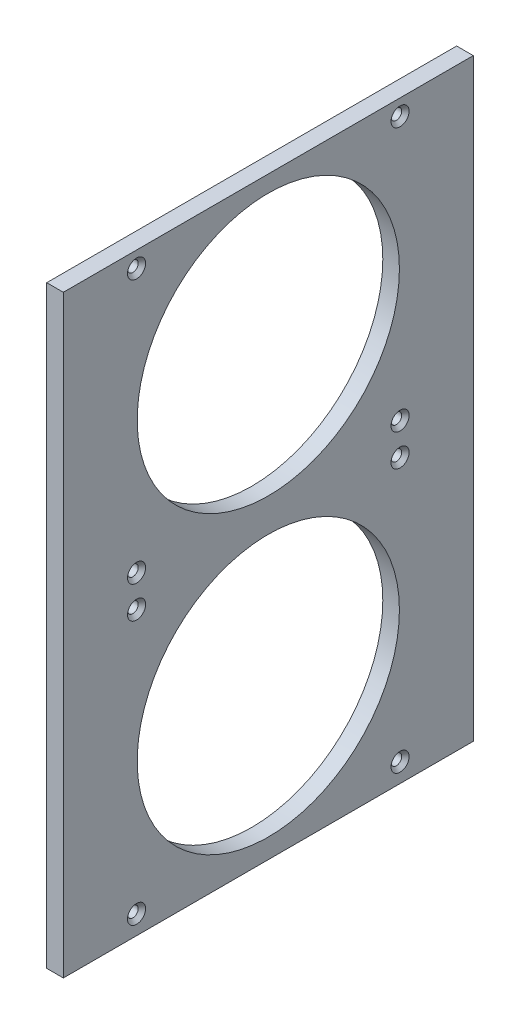
from build123d import *
from OCP.BRepFilletAPI import BRepFilletAPI_MakeChamfer

# Parameters (mm, degrees)
SKETCH1_W                     = 166.5
SKETCH1_H                     = 111
BOSS_EXTRUDE1_DEPTH           = 30.5
SHELL1_T                      = -4.5
CUT_EXTRUDE1_REACH            = 105.377
SKETCH2_W                     = 157
SKETCH2_H                     = 92
TAP_DRILL_FOR_6_32_TAP1_D     = 2.90068
TAP_DRILL_FOR_6_32_TAP1_DEPTH = 4.5
LPATTERN1_COUNT               = 8
LPATTERN1_PITCH               = 30.5
SKETCH7_W                     = 102
SKETCH7_H                     = 4.5
CUT_EXTRUDE2_DEPTH            = 5
SKETCH8_W                     = 102
SKETCH8_H                     = 157
CUT_EXTRUDE3_DEPTH            = 5
CUT_EXTRUDE4_REACH            = 302.564
SKETCH9_R                     = 35.5
TAP_DRILL_FOR_6_32_TAP2_D     = 2.90068
SKETCH13_W                    = 166.5
SKETCH13_H                    = 92
BOSS_EXTRUDE2_DEPTH           = 4.5
CUT_EXTRUDE7_DEPTH            = 157
MIRROR6_COPY_1_DEPTH          = 157
CUT_EXTRUDE11_REACH           = 364.095
SKETCH31_W                    = 5
SKETCH31_H                    = 102
SKETCH33_W                    = 4.5
SKETCH33_H                    = 149.2
BOSS_EXTRUDE3_DEPTH           = 4.5
LPATTERN2_COUNT               = 3
LPATTERN2_PITCH               = 81
CUT_EXTRUDE12_REACH           = 394.531
SKETCH34_W                    = 4.5
SKETCH34_H                    = 11.5
SKETCH35_W                    = 4.5
SKETCH35_H                    = 149.2
BOSS_EXTRUDE4_DEPTH           = 4.5
SKETCH36_W                    = 14
SKETCH36_H                    = 38
SKETCH36_W_2                  = 24
SKETCH36_H_2                  = 12
SKETCH36_W_3                  = 12
SKETCH36_H_3                  = 14
BOSS_EXTRUDE5_DEPTH           = 4.5
CUT_EXTRUDE13_REACH           = 394.531
SKETCH37_R                    = 1.45
BOSS_EXTRUDE6_START           = -4.5
BOSS_EXTRUDE6_DEPTH           = 4.5
SKETCH39_R                    = 3.5
CUT_EXTRUDE14_DEPTH           = 2.5
CUT_EXTRUDE14_DRAFT           = -39
CUT_EXTRUDE14_PROFILE_2_DEPTH = 2.5
CUT_EXTRUDE14_PROFILE_2_DRAFT = -39
CUT_EXTRUDE14_PROFILE_3_DEPTH = 2.5
CUT_EXTRUDE14_PROFILE_3_DRAFT = -39
CUT_EXTRUDE14_PROFILE_4_DEPTH = 2.5
CUT_EXTRUDE14_PROFILE_4_DRAFT = -39
CHAMFER1_SIZE                 = 4.5
SKETCH41_W                    = 166.5
SKETCH41_H                    = 314
BOSS_EXTRUDE7_DEPTH           = 4.5
CUT_EXTRUDE15_REACH           = 367.087
CHAMFER2_SIZE                 = 2.7
CHAMFER2_SIZE2                = 2.18641689
CHAMFER3_SIZE                 = 2.7
CHAMFER3_SIZE2                = 2.18641689
CHAMFER4_SIZE                 = 2.7
CHAMFER4_SIZE2                = 2.18641689
CHAMFER5_SIZE                 = 1
FILLET1_R                     = 4
FILLET2_R                     = 4
FILLET3_R                     = 4
CHAMFER6_SIZE                 = 20
CUT_EXTRUDE16_DEPTH           = 331.942309952
CUT_EXTRUDE16_DEPTH_BACK      = 331.942309952
SKETCH44_W                    = 162
SKETCH44_H                    = 248.5
CUT_EXTRUDE17_DEPTH           = 356.497538669
CUT_EXTRUDE17_DEPTH_BACK      = 356.497538669
SKETCH45_W                    = 203
SKETCH45_H                    = 248.5
CUT_EXTRUDE18_DEPTH           = 251.272851105
CUT_EXTRUDE18_DEPTH_BACK      = 251.272851105
SKETCH46_W                    = 111
SKETCH46_H                    = 87.6961641


with BuildPart() as part:
    # Sketch1 → Boss-Extrude1 (new body)
    with BuildSketch(Plane(origin=(0, 0, 0), x_dir=(1, 0, 0), z_dir=(0, 1, 0))):
        Rectangle(SKETCH1_W, SKETCH1_H)
    extrude(amount=BOSS_EXTRUDE1_DEPTH)

    # Shell1
    shell1_openings = [part.faces().sort_by_distance(p)[0] for p in [
        (0, 30.5, 0),
        (-83.25, 15.25, 0),
    ]]
    offset(amount=SHELL1_T, openings=shell1_openings, kind=Kind.INTERSECTION)

    # Sketch2 → Cut-Extrude1 (cut, up to next)
    with BuildSketch(Plane(origin=(0, 4.5, 0), x_dir=(1, 0, 0), z_dir=(0, 1, 0)), mode=Mode.PRIVATE) as cut_extrude1_sk1:
        with Locations((0.25, 0)):
            Rectangle(SKETCH2_W, SKETCH2_H)
    cut_extrude1_tool1 = extrude(cut_extrude1_sk1.sketch, amount=-CUT_EXTRUDE1_REACH, mode=Mode.PRIVATE) & part.part
    add(cut_extrude1_tool1.solids().sort_by_distance((0.25, 4.5, 0))[0], mode=Mode.SUBTRACT)

    # Tap Drill for #6-32 Tap1
    with Locations(Plane(origin=(0, 0, -55.5), x_dir=(-1, 0, 0), z_dir=(0, 0, -1))):
        with Locations((47.66, 10.84), (-53.75, 10.84)):
            tap_drill_for_6_32_tap1 = Hole(TAP_DRILL_FOR_6_32_TAP1_D / 2, depth=TAP_DRILL_FOR_6_32_TAP1_DEPTH)

    # Mirror1: Tap Drill for #6-32 Tap1 across plane
    add(tap_drill_for_6_32_tap1.mirror(Plane.XY), mode=Mode.SUBTRACT)


with BuildPart() as lpattern1_1:
    # LPattern1: pattern copy
    add(part.part.moved(Location(Vector(0, 1, 0) * (1 * LPATTERN1_PITCH))))


with BuildPart() as lpattern1_2:
    # LPattern1: pattern copy
    add(part.part.moved(Location(Vector(0, 1, 0) * (2 * LPATTERN1_PITCH))))


with BuildPart() as lpattern1_3:
    # LPattern1: pattern copy
    add(part.part.moved(Location(Vector(0, 1, 0) * (3 * LPATTERN1_PITCH))))


with BuildPart() as lpattern1_4:
    # LPattern1: pattern copy
    add(part.part.moved(Location(Vector(0, 1, 0) * (4 * LPATTERN1_PITCH))))


with BuildPart() as lpattern1_5:
    # LPattern1: pattern copy
    add(part.part.moved(Location(Vector(0, 1, 0) * (5 * LPATTERN1_PITCH))))


with BuildPart() as lpattern1_6:
    # LPattern1: pattern copy
    add(part.part.moved(Location(Vector(0, 1, 0) * (6 * LPATTERN1_PITCH))))


with BuildPart() as lpattern1_7:
    # LPattern1: pattern copy
    add(part.part.moved(Location(Vector(0, 1, 0) * (7 * LPATTERN1_PITCH))))


with BuildPart() as part_1:
    add(part.part)

    # Combine1: union LPattern1_1
    add(lpattern1_1.part)

    # Sketch7 → Cut-Extrude2 (cut)
    with BuildSketch(Plane.ZY.offset(83.25)):
        with Locations((0, 32.75)):
            Rectangle(SKETCH7_W, SKETCH7_H)
    extrude(amount=-CUT_EXTRUDE2_DEPTH, mode=Mode.SUBTRACT)


with BuildPart() as lpattern1_2_1:
    add(lpattern1_2.part)

    # Combine2: union LPattern1_3, LPattern1_5, LPattern1_4, LPattern1_7, part, LPattern1_6
    add(lpattern1_3.part)
    add(lpattern1_5.part)
    add(lpattern1_4.part)
    add(lpattern1_7.part)
    add(part_1.part)
    add(lpattern1_6.part)

    # Sketch8 → Cut-Extrude3 (cut)
    with BuildSketch(Plane.ZY.offset(83.25)):
        with Locations((0, 139.5)):
            Rectangle(SKETCH8_W, SKETCH8_H)
    extrude(amount=-CUT_EXTRUDE3_DEPTH, mode=Mode.SUBTRACT)

    # Sketch9 → Cut-Extrude4 (cut, up to next)
    with BuildSketch(Plane(origin=(83.25, 0, 0), x_dir=(0, 0, -1), z_dir=(1, 0, 0)), mode=Mode.PRIVATE) as cut_extrude4_sk1:
        with Locations((0, 204)):
            Circle(SKETCH9_R)
    cut_extrude4_tool1 = extrude(cut_extrude4_sk1.sketch, amount=-CUT_EXTRUDE4_REACH, mode=Mode.PRIVATE) & lpattern1_2_1.part
    # Sketch9 → Cut-Extrude4 (cut, up to next)
    with BuildSketch(Plane(origin=(83.25, 0, 0), x_dir=(0, 0, -1), z_dir=(1, 0, 0)), mode=Mode.PRIVATE) as cut_extrude4_sk2:
        with Locations((0, 124)):
            Circle(SKETCH9_R)
    cut_extrude4_tool2 = extrude(cut_extrude4_sk2.sketch, amount=-CUT_EXTRUDE4_REACH, mode=Mode.PRIVATE) & lpattern1_2_1.part
    # Sketch9 → Cut-Extrude4 (cut, up to next)
    with BuildSketch(Plane(origin=(83.25, 0, 0), x_dir=(0, 0, -1), z_dir=(1, 0, 0)), mode=Mode.PRIVATE) as cut_extrude4_sk3:
        with Locations((0, 44)):
            Circle(SKETCH9_R)
    cut_extrude4_tool3 = extrude(cut_extrude4_sk3.sketch, amount=-CUT_EXTRUDE4_REACH, mode=Mode.PRIVATE) & lpattern1_2_1.part
    add(cut_extrude4_tool1.solids().sort_by_distance((83.25, 204, 0))[0], mode=Mode.SUBTRACT)
    add(cut_extrude4_tool2.solids().sort_by_distance((83.25, 124, 0))[0], mode=Mode.SUBTRACT)
    add(cut_extrude4_tool3.solids().sort_by_distance((83.25, 44, 0))[0], mode=Mode.SUBTRACT)

    # Tap Drill for #6-32 Tap2 (through all)
    with Locations(Plane(origin=(83.25, 0, 0), x_dir=(0, 0, -1), z_dir=(1, 0, 0))):
        with Locations((-35.675, 239.675), (35.675, 239.675), (35.675, 168.325), (-35.675, 168.325)):
            tap_drill_for_6_32_tap2 = Hole(TAP_DRILL_FOR_6_32_TAP2_D / 2)

    # Mirror2: Tap Drill for #6-32 Tap2 across plane
    add(tap_drill_for_6_32_tap2.mirror(Plane.ZX.offset(164)), mode=Mode.SUBTRACT)

    # Mirror3: Tap Drill for #6-32 Tap2 across plane
    add(tap_drill_for_6_32_tap2.mirror(Plane.ZX.offset(124)), mode=Mode.SUBTRACT)

    # Sketch13 → Boss-Extrude2 (add)
    with BuildSketch(Plane.XZ):
        with Locations((0, -101.5)):
            Rectangle(SKETCH13_W, SKETCH13_H)
    extrude(amount=-BOSS_EXTRUDE2_DEPTH)

    # Mirror4: LPattern1_2 across plane


with BuildPart() as lpattern1_2_2:
    add(lpattern1_2_1.part)
    add(lpattern1_2_1.part.mirror(Plane(origin=(0, 0, -101.5), x_dir=(1, 0, 0), z_dir=(0, 0, -1))))

    # Sketch17 → Cut-Extrude7 (cut)
    with BuildSketch(Plane.ZY.offset(78.25)):
        Polygon((-46, 35), (-51, 30.5), (-46, 30.5), align=None)
        Polygon((-51, 61), (-46, 65.5), (-46, 61), align=None)
        Polygon((-51, 91.5), (-46, 96), (-46, 91.5), align=None)
        Polygon((-51, 122), (-46, 126.5), (-46, 122), align=None)
        Polygon((-51, 152.5), (-46, 157), (-46, 152.5), align=None)
        Polygon((-51, 183), (-46, 187.5), (-46, 183), align=None)
        Polygon((-51, 213.5), (-46, 218), (-46, 213.5), align=None)
    cut_extrude7 = extrude(amount=-CUT_EXTRUDE7_DEPTH, mode=Mode.SUBTRACT)

    # Mirror5: Cut-Extrude7 across plane
    add(cut_extrude7.mirror(Plane.XY), mode=Mode.SUBTRACT)

    # Mirror6: Cut-Extrude7 across plane
    add(cut_extrude7.mirror(Plane(origin=(0, 0, -101.5), x_dir=(1, 0, 0), z_dir=(0, 0, -1))), mode=Mode.SUBTRACT)

    # Mirror6 copy 1 sketch → Mirror6 copy 1 (cut)
    with BuildSketch(Plane(origin=(-78.25, 0, -203), x_dir=(0, 0, 1), z_dir=(-1, 0, 0))):
        Polygon((-46, 35), (-51, 30.5), (-46, 30.5), align=None)
        Polygon((-51, 61), (-46, 65.5), (-46, 61), align=None)
        Polygon((-51, 91.5), (-46, 96), (-46, 91.5), align=None)
        Polygon((-51, 122), (-46, 126.5), (-46, 122), align=None)
        Polygon((-51, 152.5), (-46, 157), (-46, 152.5), align=None)
        Polygon((-51, 183), (-46, 187.5), (-46, 183), align=None)
        Polygon((-51, 213.5), (-46, 218), (-46, 213.5), align=None)
    extrude(amount=-MIRROR6_COPY_1_DEPTH, mode=Mode.SUBTRACT)

    # Sketch31 → Cut-Extrude11 (cut, up to next)
    with BuildSketch(Plane(origin=(0, 4.5, 0), x_dir=(1, 0, 0), z_dir=(0, 1, 0)), mode=Mode.PRIVATE) as cut_extrude11_sk1:
        with Locations((-80.75, 203)):
            Rectangle(SKETCH31_W, SKETCH31_H)
    cut_extrude11_tool1 = extrude(cut_extrude11_sk1.sketch, amount=-CUT_EXTRUDE11_REACH, mode=Mode.PRIVATE) & lpattern1_2_2.part
    # Sketch31 → Cut-Extrude11 (cut, up to next)
    with BuildSketch(Plane(origin=(0, 4.5, 0), x_dir=(1, 0, 0), z_dir=(0, 1, 0)), mode=Mode.PRIVATE) as cut_extrude11_sk2:
        with Locations((-80.75, 0)):
            Rectangle(SKETCH31_W, SKETCH31_H)
    cut_extrude11_tool2 = extrude(cut_extrude11_sk2.sketch, amount=-CUT_EXTRUDE11_REACH, mode=Mode.PRIVATE) & lpattern1_2_2.part
    add(cut_extrude11_tool1.solids().sort_by_distance((-80.75, 4.5, -203))[0], mode=Mode.SUBTRACT)
    add(cut_extrude11_tool2.solids().sort_by_distance((-80.75, 4.5, 0))[0], mode=Mode.SUBTRACT)

    # Sketch33 → Boss-Extrude3 (add)
    with BuildSketch(Plane(origin=(83.25, 0, 0), x_dir=(0, 0, -1), z_dir=(1, 0, 0))):
        with Locations((145.25, 79.1)):
            Rectangle(SKETCH33_W, SKETCH33_H)
    boss_extrude3 = extrude(amount=-BOSS_EXTRUDE3_DEPTH)

    # LPattern2: Boss-Extrude3 ×3
    with Locations(*[(-i * LPATTERN2_PITCH, 0, 0) for i in range(1, LPATTERN2_COUNT)]):
        add(boss_extrude3)

    # Cut-Extrude12: up to this face of the body (flat: up to its plane)
    cut_extrude12_end = Plane(lpattern1_2_2.part.faces().sort_by_distance((2.25, 79.1, -145.25))[0])
    # Sketch34 → Cut-Extrude12 (cut, up to the picked face)
    with BuildSketch(Plane.ZY.offset(83.25), mode=Mode.PRIVATE) as cut_extrude12_sk1:
        Polygon((-147.5, 25), (-143, 25), (-143, 81.35), (-147.5, 76.85), align=None)
    cut_extrude12_tool1 = split(extrude(cut_extrude12_sk1.sketch, amount=-CUT_EXTRUDE12_REACH, mode=Mode.PRIVATE), bisect_by=cut_extrude12_end, keep=Keep.BOTH, mode=Mode.PRIVATE)
    # Sketch34 → Cut-Extrude12 (cut, up to the picked face)
    with BuildSketch(Plane.ZY.offset(83.25), mode=Mode.PRIVATE) as cut_extrude12_sk2:
        with Locations((-145.25, 19.25)):
            Rectangle(SKETCH34_W, SKETCH34_H)
    cut_extrude12_tool2 = split(extrude(cut_extrude12_sk2.sketch, amount=-CUT_EXTRUDE12_REACH, mode=Mode.PRIVATE), bisect_by=cut_extrude12_end, keep=Keep.BOTH, mode=Mode.PRIVATE)
    # Sketch34 → Cut-Extrude12 (cut, up to the picked face)
    with BuildSketch(Plane.ZY.offset(83.25), mode=Mode.PRIVATE) as cut_extrude12_sk3:
        Polygon((-143, 145.7), (-143, 89.35), (-147.5, 89.35), (-147.5, 141.2), align=None)
    cut_extrude12_tool3 = split(extrude(cut_extrude12_sk3.sketch, amount=-CUT_EXTRUDE12_REACH, mode=Mode.PRIVATE), bisect_by=cut_extrude12_end, keep=Keep.BOTH, mode=Mode.PRIVATE)
    add(cut_extrude12_tool1.solids().sort_by(Axis((-83.25, 52.065596, -145.218808), (1, 0, 0)))[0], mode=Mode.SUBTRACT)
    add(cut_extrude12_tool2.solids().sort_by(Axis((-83.25, 19.25, -145.25), (1, 0, 0)))[0], mode=Mode.SUBTRACT)
    add(cut_extrude12_tool3.solids().sort_by(Axis((-83.25, 116.415596, -145.218808), (1, 0, 0)))[0], mode=Mode.SUBTRACT)

    # Sketch35 → Boss-Extrude4 (add)
    with BuildSketch(Plane.ZY.offset(-78.75)):
        with Locations((-145.25, 79.1)):
            Rectangle(SKETCH35_W, SKETCH35_H)
    extrude(amount=BOSS_EXTRUDE4_DEPTH)

    # Sketch36 → Boss-Extrude5 (add)
    with BuildSketch(Plane(origin=(83.25, 0, 0), x_dir=(0, 0, -1), z_dir=(1, 0, 0))):
        with Locations((62.5, 23.5)):
            Rectangle(SKETCH36_W, SKETCH36_H)
        with Locations((67.5, 147.7)):
            Rectangle(SKETCH36_W_2, SKETCH36_H_2)
        with Locations((137, 146.7)):
            Rectangle(SKETCH36_W_3, SKETCH36_H_3)
        with Locations((136, 10.5)):
            Rectangle(SKETCH36_W, SKETCH36_H_2)
    extrude(amount=-BOSS_EXTRUDE5_DEPTH)

    # Sketch37 → Cut-Extrude13 (cut, up to next)
    with BuildSketch(Plane(origin=(83.25, 0, 0), x_dir=(0, 0, -1), z_dir=(1, 0, 0)), mode=Mode.PRIVATE) as cut_extrude13_sk1:
        with Locations((71.32, 147.92)):
            Circle(SKETCH37_R)
    cut_extrude13_tool1 = extrude(cut_extrude13_sk1.sketch, amount=-CUT_EXTRUDE13_REACH, mode=Mode.PRIVATE) & lpattern1_2_2.part
    # Sketch37 → Cut-Extrude13 (cut, up to next)
    with BuildSketch(Plane(origin=(83.25, 0, 0), x_dir=(0, 0, -1), z_dir=(1, 0, 0)), mode=Mode.PRIVATE) as cut_extrude13_sk2:
        with Locations((137.68, 147.92)):
            Circle(SKETCH37_R)
    cut_extrude13_tool2 = extrude(cut_extrude13_sk2.sketch, amount=-CUT_EXTRUDE13_REACH, mode=Mode.PRIVATE) & lpattern1_2_2.part
    # Sketch37 → Cut-Extrude13 (cut, up to next)
    with BuildSketch(Plane(origin=(83.25, 0, 0), x_dir=(0, 0, -1), z_dir=(1, 0, 0)), mode=Mode.PRIVATE) as cut_extrude13_sk3:
        with Locations((61.57, 34.51)):
            Circle(SKETCH37_R)
    cut_extrude13_tool3 = extrude(cut_extrude13_sk3.sketch, amount=-CUT_EXTRUDE13_REACH, mode=Mode.PRIVATE) & lpattern1_2_2.part
    # Sketch37 → Cut-Extrude13 (cut, up to next)
    with BuildSketch(Plane(origin=(83.25, 0, 0), x_dir=(0, 0, -1), z_dir=(1, 0, 0)), mode=Mode.PRIVATE) as cut_extrude13_sk4:
        with Locations((137.55, 10.15)):
            Circle(SKETCH37_R)
    cut_extrude13_tool4 = extrude(cut_extrude13_sk4.sketch, amount=-CUT_EXTRUDE13_REACH, mode=Mode.PRIVATE) & lpattern1_2_2.part
    add(cut_extrude13_tool1.solids().sort_by_distance((83.25, 147.92, -71.32))[0], mode=Mode.SUBTRACT)
    add(cut_extrude13_tool2.solids().sort_by_distance((83.25, 147.92, -137.68))[0], mode=Mode.SUBTRACT)
    add(cut_extrude13_tool3.solids().sort_by_distance((83.25, 34.51, -61.57))[0], mode=Mode.SUBTRACT)
    add(cut_extrude13_tool4.solids().sort_by_distance((83.25, 10.15, -137.55))[0], mode=Mode.SUBTRACT)

    # Sketch38 → Boss-Extrude6 (add)
    with BuildSketch(Plane(origin=(83.25, 0, 0), x_dir=(0, 0, -1), z_dir=(1, 0, 0)).offset(BOSS_EXTRUDE6_START)):
        Polygon((79.5, 141.7), (55.5, 117.7), (55.5, 141.7), align=None)
        Polygon((131, 139.7), (143, 127.7), (143, 139.7), align=None)
    extrude(amount=BOSS_EXTRUDE6_DEPTH)


with BuildPart() as cut_extrude14_tool:
    # Sketch39 → Cut-Extrude14 (with draft: the straight prism first)
    with BuildSketch(Plane(origin=(83.25, 0, 0), x_dir=(0, 0, -1), z_dir=(1, 0, 0))):
        with Locations((71.32, 147.92)):
            Circle(SKETCH39_R)
    extrude(amount=-CUT_EXTRUDE14_DEPTH)
    # Cut-Extrude14: the draft: its side faces are tilted about the plane it starts from
    cut_extrude14_sides = [cut_extrude14_tool.faces().sort_by_distance(p)[0] for p in [
        (82, 147.92, -67.82),
    ]]
    draft(cut_extrude14_sides, Plane(origin=(83.25, 0, 0), x_dir=(0, 0, -1), z_dir=(1, 0, 0)), CUT_EXTRUDE14_DRAFT)


with BuildPart() as lpattern1_2_3:
    add(lpattern1_2_2.part)

    # Cut-Extrude14: cut by cut_extrude14_tool
    add(cut_extrude14_tool.part, mode=Mode.SUBTRACT)


with BuildPart() as cut_extrude14_profile_2_tool:
    # Sketch39 → Cut-Extrude14 profile 2 (with draft: the straight prism first)
    with BuildSketch(Plane(origin=(83.25, 0, 0), x_dir=(0, 0, -1), z_dir=(1, 0, 0))):
        with Locations((137.68, 147.92)):
            Circle(SKETCH39_R)
    extrude(amount=-CUT_EXTRUDE14_PROFILE_2_DEPTH)
    # Cut-Extrude14 profile 2: the draft: its side faces are tilted about the plane it starts from
    cut_extrude14_profile_2_sides = [cut_extrude14_profile_2_tool.faces().sort_by_distance(p)[0] for p in [
        (82, 147.92, -134.18),
    ]]
    draft(cut_extrude14_profile_2_sides, Plane(origin=(83.25, 0, 0), x_dir=(0, 0, -1), z_dir=(1, 0, 0)), CUT_EXTRUDE14_PROFILE_2_DRAFT)


with BuildPart() as lpattern1_2_4:
    add(lpattern1_2_3.part)

    # Cut-Extrude14 profile 2: cut by cut_extrude14_profile_2_tool
    add(cut_extrude14_profile_2_tool.part, mode=Mode.SUBTRACT)


with BuildPart() as cut_extrude14_profile_3_tool:
    # Sketch39 → Cut-Extrude14 profile 3 (with draft: the straight prism first)
    with BuildSketch(Plane(origin=(83.25, 0, 0), x_dir=(0, 0, -1), z_dir=(1, 0, 0))):
        with Locations((137.55, 10.15)):
            Circle(SKETCH39_R)
    extrude(amount=-CUT_EXTRUDE14_PROFILE_3_DEPTH)
    # Cut-Extrude14 profile 3: the draft: its side faces are tilted about the plane it starts from
    cut_extrude14_profile_3_sides = [cut_extrude14_profile_3_tool.faces().sort_by_distance(p)[0] for p in [
        (82, 10.15, -134.05),
    ]]
    draft(cut_extrude14_profile_3_sides, Plane(origin=(83.25, 0, 0), x_dir=(0, 0, -1), z_dir=(1, 0, 0)), CUT_EXTRUDE14_PROFILE_3_DRAFT)


with BuildPart() as lpattern1_2_5:
    add(lpattern1_2_4.part)

    # Cut-Extrude14 profile 3: cut by cut_extrude14_profile_3_tool
    add(cut_extrude14_profile_3_tool.part, mode=Mode.SUBTRACT)


with BuildPart() as cut_extrude14_profile_4_tool:
    # Sketch39 → Cut-Extrude14 profile 4 (with draft: the straight prism first)
    with BuildSketch(Plane(origin=(83.25, 0, 0), x_dir=(0, 0, -1), z_dir=(1, 0, 0))):
        with Locations((61.57, 34.51)):
            Circle(SKETCH39_R)
    extrude(amount=-CUT_EXTRUDE14_PROFILE_4_DEPTH)
    # Cut-Extrude14 profile 4: the draft: its side faces are tilted about the plane it starts from
    cut_extrude14_profile_4_sides = [cut_extrude14_profile_4_tool.faces().sort_by_distance(p)[0] for p in [
        (82, 34.51, -58.07),
    ]]
    draft(cut_extrude14_profile_4_sides, Plane(origin=(83.25, 0, 0), x_dir=(0, 0, -1), z_dir=(1, 0, 0)), CUT_EXTRUDE14_PROFILE_4_DRAFT)


with BuildPart() as lpattern1_2_6:
    add(lpattern1_2_5.part)

    # Cut-Extrude14 profile 4: cut by cut_extrude14_profile_4_tool
    add(cut_extrude14_profile_4_tool.part, mode=Mode.SUBTRACT)

    # Chamfer1
    chamfer1_edges = [lpattern1_2_6.edges().sort_by_distance(p)[0] for p in [
        (81, 42.5, -69.5),
        (81, 153.7, -79.5),
        (81, 153.7, -131),
        (81, 16.5, -129),
    ]]
    chamfer(chamfer1_edges, length=CHAMFER1_SIZE)

    # Sketch41 → Boss-Extrude7 (add)
    with BuildSketch(Plane.XZ):
        with Locations((0, -101.5)):
            Rectangle(SKETCH41_W, SKETCH41_H)
    extrude(amount=BOSS_EXTRUDE7_DEPTH)

    # Sketch42 → Cut-Extrude15 (cut, up to next)
    with BuildSketch(Plane(origin=(0, 0, 0), x_dir=(1, 0, 0), z_dir=(0, 1, 0)), mode=Mode.PRIVATE) as cut_extrude15_sk1:
        with BuildLine():
            Line((-43.85503675, 38), (43.85503675, 38))
            ThreePointArc((43.85503675, 38), (46.750439422, 35.78526643), (45.370811763, 32.411095577))
            Line((45.370811763, 32.411095577), (1.515775013, 6.73445479))
            ThreePointArc((1.515775013, 6.73445479), (0, 6.323359212), (-1.515775013, 6.73445479))
            Line((-1.515775013, 6.73445479), (-45.370811763, 32.411095577))
            ThreePointArc((-45.370811763, 32.411095577), (-46.750439422, 35.78526643), (-43.85503675, 38))
        make_face()
    cut_extrude15_tool1 = extrude(cut_extrude15_sk1.sketch, amount=-CUT_EXTRUDE15_REACH, mode=Mode.PRIVATE) & lpattern1_2_6.part
    # Sketch42 → Cut-Extrude15 (cut, up to next)
    with BuildSketch(Plane(origin=(0, 0, 0), x_dir=(1, 0, 0), z_dir=(0, 1, 0)), mode=Mode.PRIVATE) as cut_extrude15_sk2:
        with BuildLine():
            Line((10.268766853, 2.588904423), (66.234224987, 35.356063488))
            ThreePointArc((66.234224987, 35.356063488), (69.242091646, 35.369785147), (70.75, 32.767159066))
            Line((70.75, 32.767159066), (70.75, -32.767159066))
            ThreePointArc((70.75, -32.767159066), (69.242091646, -35.369785147), (66.234224987, -35.356063488))
            Line((66.234224987, -35.356063488), (10.268766853, -2.588904423))
            ThreePointArc((10.268766853, -2.588904423), (8.784541866, 0), (10.268766853, 2.588904423))
        make_face()
    cut_extrude15_tool2 = extrude(cut_extrude15_sk2.sketch, amount=-CUT_EXTRUDE15_REACH, mode=Mode.PRIVATE) & lpattern1_2_6.part
    # Sketch42 → Cut-Extrude15 (cut, up to next)
    with BuildSketch(Plane(origin=(0, 0, 0), x_dir=(1, 0, 0), z_dir=(0, 1, 0)), mode=Mode.PRIVATE) as cut_extrude15_sk3:
        with BuildLine():
            Line((45.370811763, -32.411095577), (1.515775013, -6.73445479))
            ThreePointArc((1.515775013, -6.73445479), (0, -6.323359212), (-1.515775013, -6.73445479))
            Line((-1.515775013, -6.73445479), (-45.370811763, -32.411095577))
            ThreePointArc((-45.370811763, -32.411095577), (-46.750439422, -35.78526643), (-43.85503675, -38))
            Line((-43.85503675, -38), (43.85503675, -38))
            ThreePointArc((43.85503675, -38), (46.750439422, -35.78526643), (45.370811763, -32.411095577))
        make_face()
    cut_extrude15_tool3 = extrude(cut_extrude15_sk3.sketch, amount=-CUT_EXTRUDE15_REACH, mode=Mode.PRIVATE) & lpattern1_2_6.part
    # Sketch42 → Cut-Extrude15 (cut, up to next)
    with BuildSketch(Plane(origin=(0, 0, 0), x_dir=(1, 0, 0), z_dir=(0, 1, 0)), mode=Mode.PRIVATE) as cut_extrude15_sk4:
        with BuildLine():
            Line((-70.717599058, 32.346124545), (-70.327517287, -33.187032629))
            ThreePointArc((-70.327517287, -33.187032629), (-68.804143961, -35.780637039), (-65.796412263, -35.749011813))
            Line((-65.796412263, -35.749011813), (-10.026986458, -2.64930845))
            ThreePointArc((-10.026986458, -2.64930845), (-8.558197773, -0.051615297), (-10.057806476, 2.528408669))
            Line((-10.057806476, 2.528408669), (-66.217314052, 34.961862479))
            ThreePointArc((-66.217314052, 34.961862479), (-69.225209102, 34.957680085), (-70.717599058, 32.346124545))
        make_face()
    cut_extrude15_tool4 = extrude(cut_extrude15_sk4.sketch, amount=-CUT_EXTRUDE15_REACH, mode=Mode.PRIVATE) & lpattern1_2_6.part
    cut_extrude15_1 = cut_extrude15_tool1.solids().sort_by_distance((0, 0, -27.06052))[0]
    add(cut_extrude15_1, mode=Mode.SUBTRACT)
    cut_extrude15_2 = cut_extrude15_tool2.solids().sort_by_distance((49.111692, 0, 0))[0]
    add(cut_extrude15_2, mode=Mode.SUBTRACT)
    cut_extrude15_3 = cut_extrude15_tool3.solids().sort_by_distance((0, 0, 27.06052))[0]
    add(cut_extrude15_3, mode=Mode.SUBTRACT)
    cut_extrude15_4 = cut_extrude15_tool4.solids().sort_by_distance((-48.884634, 0, 0.291656))[0]
    add(cut_extrude15_4, mode=Mode.SUBTRACT)
    cut_extrude15 = cut_extrude15_1 + cut_extrude15_2 + cut_extrude15_3 + cut_extrude15_4  # Cut-Extrude15 as one shape, for the pattern or mirror that repeats it

    # Mirror7: Cut-Extrude15 across plane
    add(cut_extrude15.mirror(Plane(origin=(0, 0, -101.5), x_dir=(1, 0, 0), z_dir=(0, 0, -1))), mode=Mode.SUBTRACT)

    # Chamfer2
    chamfer2_edges = [lpattern1_2_6.edges().sort_by_distance(p)[0] for p in [
        (52.29966, 10.84, 55.5),
        (-49.11034, 10.84, 55.5),
        (52.29966, 41.34, 55.5),
        (-49.11034, 41.34, 55.5),
        (52.29966, 71.84, 55.5),
        (-49.11034, 71.84, 55.5),
        (52.29966, 102.34, 55.5),
        (-49.11034, 102.34, 55.5),
        (52.29966, 163.34, 55.5),
        (-49.11034, 163.34, 55.5),
        (52.29966, 132.84, 55.5),
        (-49.11034, 132.84, 55.5),
        (52.29966, 224.34, 55.5),
        (-49.11034, 224.34, 55.5),
        (52.29966, 193.84, 55.5),
        (-49.11034, 193.84, 55.5),
    ]]
    chamfer2_side = [lpattern1_2_6.faces().sort_by_distance(p)[0] for p in [
        (-0.007801308, 119.755533933, 55.5),
    ]]
    chamfer(chamfer2_edges, length=CHAMFER2_SIZE, length2=CHAMFER2_SIZE2, reference=chamfer2_side[0])

    # Chamfer3
    chamfer3_edges = [lpattern1_2_6.edges().sort_by_distance(p)[0] for p in [
        (52.29966, 10.84, -55.5),
        (-49.11034, 10.84, -55.5),
        (52.29966, 41.34, -55.5),
        (-49.11034, 41.34, -55.5),
        (52.29966, 71.84, -55.5),
        (-49.11034, 71.84, -55.5),
        (52.29966, 102.34, -55.5),
        (-49.11034, 102.34, -55.5),
        (52.29966, 163.34, -55.5),
        (-49.11034, 163.34, -55.5),
        (52.29966, 132.84, -55.5),
        (-49.11034, 132.84, -55.5),
        (52.29966, 224.34, -55.5),
        (-49.11034, 224.34, -55.5),
        (52.29966, 193.84, -55.5),
        (-49.11034, 193.84, -55.5),
    ]]
    chamfer3_side = [lpattern1_2_6.faces().sort_by_distance(p)[0] for p in [
        (-0.692097578, 124.65766578, -55.5),
    ]]
    chamfer(chamfer3_edges, length=CHAMFER3_SIZE, length2=CHAMFER3_SIZE2, reference=chamfer3_side[0])

    # Chamfer4: one chamfer whose edges measure the first distance from different faces: ONE call of the kernel's chamfer builder (chamfer() names one face for all edges)
    chamfer4_edges_1 = [lpattern1_2_6.edges().sort_by_distance(p)[0] for p in [
        (-49.11034, 71.84, -147.5),
    ]]
    chamfer4_side_1 = [lpattern1_2_6.faces().sort_by_distance(p)[0] for p in [
        (-49.11034, 71.84, -149.75),
    ]]
    chamfer4_edges_2 = [lpattern1_2_6.edges().sort_by_distance(p)[0] for p in [
        (52.29966, 71.84, -147.5),
    ]]
    chamfer4_side_2 = [lpattern1_2_6.faces().sort_by_distance(p)[0] for p in [
        (52.29966, 71.84, -149.75),
    ]]
    chamfer4_edges_3 = [lpattern1_2_6.edges().sort_by_distance(p)[0] for p in [
        (-49.11034, 102.34, -147.5),
    ]]
    chamfer4_side_3 = [lpattern1_2_6.faces().sort_by_distance(p)[0] for p in [
        (-49.11034, 102.34, -149.75),
    ]]
    chamfer4_edges_4 = [lpattern1_2_6.edges().sort_by_distance(p)[0] for p in [
        (52.29966, 102.34, -147.5),
    ]]
    chamfer4_side_4 = [lpattern1_2_6.faces().sort_by_distance(p)[0] for p in [
        (52.29966, 102.34, -149.75),
    ]]
    chamfer4_edges_5 = [lpattern1_2_6.edges().sort_by_distance(p)[0] for p in [
        (-49.11034, 163.34, -147.5),
    ]]
    chamfer4_side_5 = [lpattern1_2_6.faces().sort_by_distance(p)[0] for p in [
        (-49.11034, 163.34, -149.75),
    ]]
    chamfer4_edges_6 = [lpattern1_2_6.edges().sort_by_distance(p)[0] for p in [
        (52.29966, 163.34, -147.5),
    ]]
    chamfer4_side_6 = [lpattern1_2_6.faces().sort_by_distance(p)[0] for p in [
        (52.29966, 163.34, -149.75),
    ]]
    chamfer4_edges_7 = [lpattern1_2_6.edges().sort_by_distance(p)[0] for p in [
        (-49.11034, 132.84, -147.5),
    ]]
    chamfer4_side_7 = [lpattern1_2_6.faces().sort_by_distance(p)[0] for p in [
        (-49.11034, 132.84, -149.75),
    ]]
    chamfer4_edges_8 = [lpattern1_2_6.edges().sort_by_distance(p)[0] for p in [
        (52.29966, 132.84, -147.5),
    ]]
    chamfer4_side_8 = [lpattern1_2_6.faces().sort_by_distance(p)[0] for p in [
        (52.29966, 132.84, -149.75),
    ]]
    chamfer4_edges_9 = [lpattern1_2_6.edges().sort_by_distance(p)[0] for p in [
        (-49.11034, 224.34, -147.5),
    ]]
    chamfer4_side_9 = [lpattern1_2_6.faces().sort_by_distance(p)[0] for p in [
        (-49.11034, 224.34, -149.75),
    ]]
    chamfer4_edges_10 = [lpattern1_2_6.edges().sort_by_distance(p)[0] for p in [
        (52.29966, 224.34, -147.5),
    ]]
    chamfer4_side_10 = [lpattern1_2_6.faces().sort_by_distance(p)[0] for p in [
        (52.29966, 224.34, -149.75),
    ]]
    chamfer4_edges_11 = [lpattern1_2_6.edges().sort_by_distance(p)[0] for p in [
        (-49.11034, 193.84, -147.5),
    ]]
    chamfer4_side_11 = [lpattern1_2_6.faces().sort_by_distance(p)[0] for p in [
        (-49.11034, 193.84, -149.75),
    ]]
    chamfer4_edges_12 = [lpattern1_2_6.edges().sort_by_distance(p)[0] for p in [
        (52.29966, 193.84, -147.5),
    ]]
    chamfer4_side_12 = [lpattern1_2_6.faces().sort_by_distance(p)[0] for p in [
        (52.29966, 193.84, -149.75),
    ]]
    chamfer4_edges_13 = [lpattern1_2_6.edges().sort_by_distance(p)[0] for p in [
        (-49.11034, 10.84, -147.5),
    ]]
    chamfer4_side_13 = [lpattern1_2_6.faces().sort_by_distance(p)[0] for p in [
        (-49.11034, 10.84, -149.75),
    ]]
    chamfer4_edges_14 = [lpattern1_2_6.edges().sort_by_distance(p)[0] for p in [
        (52.29966, 10.84, -147.5),
    ]]
    chamfer4_side_14 = [lpattern1_2_6.faces().sort_by_distance(p)[0] for p in [
        (52.29966, 10.84, -149.75),
    ]]
    chamfer4_edges_15 = [lpattern1_2_6.edges().sort_by_distance(p)[0] for p in [
        (-49.11034, 41.34, -147.5),
    ]]
    chamfer4_side_15 = [lpattern1_2_6.faces().sort_by_distance(p)[0] for p in [
        (-49.11034, 41.34, -149.75),
    ]]
    chamfer4_edges_16 = [lpattern1_2_6.edges().sort_by_distance(p)[0] for p in [
        (52.29966, 41.34, -147.5),
    ]]
    chamfer4_side_16 = [lpattern1_2_6.faces().sort_by_distance(p)[0] for p in [
        (52.29966, 41.34, -149.75),
    ]]
    chamfer4_edges_17 = [lpattern1_2_6.edges().sort_by_distance(p)[0] for p in [
        (-49.11034, 71.84, -258.5),
    ]]
    chamfer4_side_17 = [lpattern1_2_6.faces().sort_by_distance(p)[0] for p in [
        (-49.11034, 71.84, -256.25),
    ]]
    chamfer4_edges_18 = [lpattern1_2_6.edges().sort_by_distance(p)[0] for p in [
        (52.29966, 71.84, -258.5),
    ]]
    chamfer4_side_18 = [lpattern1_2_6.faces().sort_by_distance(p)[0] for p in [
        (52.29966, 71.84, -256.25),
    ]]
    chamfer4_edges_19 = [lpattern1_2_6.edges().sort_by_distance(p)[0] for p in [
        (-49.11034, 102.34, -258.5),
    ]]
    chamfer4_side_19 = [lpattern1_2_6.faces().sort_by_distance(p)[0] for p in [
        (-49.11034, 102.34, -256.25),
    ]]
    chamfer4_edges_20 = [lpattern1_2_6.edges().sort_by_distance(p)[0] for p in [
        (52.29966, 102.34, -258.5),
    ]]
    chamfer4_side_20 = [lpattern1_2_6.faces().sort_by_distance(p)[0] for p in [
        (52.29966, 102.34, -256.25),
    ]]
    chamfer4_edges_21 = [lpattern1_2_6.edges().sort_by_distance(p)[0] for p in [
        (-49.11034, 163.34, -258.5),
    ]]
    chamfer4_side_21 = [lpattern1_2_6.faces().sort_by_distance(p)[0] for p in [
        (-49.11034, 163.34, -256.25),
    ]]
    chamfer4_edges_22 = [lpattern1_2_6.edges().sort_by_distance(p)[0] for p in [
        (52.29966, 163.34, -258.5),
    ]]
    chamfer4_side_22 = [lpattern1_2_6.faces().sort_by_distance(p)[0] for p in [
        (52.29966, 163.34, -256.25),
    ]]
    chamfer4_edges_23 = [lpattern1_2_6.edges().sort_by_distance(p)[0] for p in [
        (-49.11034, 132.84, -258.5),
    ]]
    chamfer4_side_23 = [lpattern1_2_6.faces().sort_by_distance(p)[0] for p in [
        (-49.11034, 132.84, -256.25),
    ]]
    chamfer4_edges_24 = [lpattern1_2_6.edges().sort_by_distance(p)[0] for p in [
        (52.29966, 132.84, -258.5),
    ]]
    chamfer4_side_24 = [lpattern1_2_6.faces().sort_by_distance(p)[0] for p in [
        (52.29966, 132.84, -256.25),
    ]]
    chamfer4_edges_25 = [lpattern1_2_6.edges().sort_by_distance(p)[0] for p in [
        (-49.11034, 224.34, -258.5),
    ]]
    chamfer4_side_25 = [lpattern1_2_6.faces().sort_by_distance(p)[0] for p in [
        (-49.11034, 224.34, -256.25),
    ]]
    chamfer4_edges_26 = [lpattern1_2_6.edges().sort_by_distance(p)[0] for p in [
        (52.29966, 224.34, -258.5),
    ]]
    chamfer4_side_26 = [lpattern1_2_6.faces().sort_by_distance(p)[0] for p in [
        (52.29966, 224.34, -256.25),
    ]]
    chamfer4_edges_27 = [lpattern1_2_6.edges().sort_by_distance(p)[0] for p in [
        (-49.11034, 193.84, -258.5),
    ]]
    chamfer4_side_27 = [lpattern1_2_6.faces().sort_by_distance(p)[0] for p in [
        (-49.11034, 193.84, -256.25),
    ]]
    chamfer4_edges_28 = [lpattern1_2_6.edges().sort_by_distance(p)[0] for p in [
        (52.29966, 193.84, -258.5),
    ]]
    chamfer4_side_28 = [lpattern1_2_6.faces().sort_by_distance(p)[0] for p in [
        (52.29966, 193.84, -256.25),
    ]]
    chamfer4_edges_29 = [lpattern1_2_6.edges().sort_by_distance(p)[0] for p in [
        (-49.11034, 10.84, -258.5),
    ]]
    chamfer4_side_29 = [lpattern1_2_6.faces().sort_by_distance(p)[0] for p in [
        (-49.11034, 10.84, -256.25),
    ]]
    chamfer4_edges_30 = [lpattern1_2_6.edges().sort_by_distance(p)[0] for p in [
        (52.29966, 10.84, -258.5),
    ]]
    chamfer4_side_30 = [lpattern1_2_6.faces().sort_by_distance(p)[0] for p in [
        (52.29966, 10.84, -256.25),
    ]]
    chamfer4_edges_31 = [lpattern1_2_6.edges().sort_by_distance(p)[0] for p in [
        (-49.11034, 41.34, -258.5),
    ]]
    chamfer4_side_31 = [lpattern1_2_6.faces().sort_by_distance(p)[0] for p in [
        (-49.11034, 41.34, -256.25),
    ]]
    chamfer4_edges_32 = [lpattern1_2_6.edges().sort_by_distance(p)[0] for p in [
        (52.29966, 41.34, -258.5),
    ]]
    chamfer4_side_32 = [lpattern1_2_6.faces().sort_by_distance(p)[0] for p in [
        (52.29966, 41.34, -256.25),
    ]]
    chamfer4 = BRepFilletAPI_MakeChamfer(lpattern1_2_6.part.solid().wrapped)
    for e in chamfer4_edges_1:
        chamfer4.Add(CHAMFER4_SIZE, CHAMFER4_SIZE2, e.wrapped, chamfer4_side_1[0].wrapped)  # the first distance lies on this face
    for e in chamfer4_edges_2:
        chamfer4.Add(CHAMFER4_SIZE, CHAMFER4_SIZE2, e.wrapped, chamfer4_side_2[0].wrapped)  # the first distance lies on this face
    for e in chamfer4_edges_3:
        chamfer4.Add(CHAMFER4_SIZE, CHAMFER4_SIZE2, e.wrapped, chamfer4_side_3[0].wrapped)  # the first distance lies on this face
    for e in chamfer4_edges_4:
        chamfer4.Add(CHAMFER4_SIZE, CHAMFER4_SIZE2, e.wrapped, chamfer4_side_4[0].wrapped)  # the first distance lies on this face
    for e in chamfer4_edges_5:
        chamfer4.Add(CHAMFER4_SIZE, CHAMFER4_SIZE2, e.wrapped, chamfer4_side_5[0].wrapped)  # the first distance lies on this face
    for e in chamfer4_edges_6:
        chamfer4.Add(CHAMFER4_SIZE, CHAMFER4_SIZE2, e.wrapped, chamfer4_side_6[0].wrapped)  # the first distance lies on this face
    for e in chamfer4_edges_7:
        chamfer4.Add(CHAMFER4_SIZE, CHAMFER4_SIZE2, e.wrapped, chamfer4_side_7[0].wrapped)  # the first distance lies on this face
    for e in chamfer4_edges_8:
        chamfer4.Add(CHAMFER4_SIZE, CHAMFER4_SIZE2, e.wrapped, chamfer4_side_8[0].wrapped)  # the first distance lies on this face
    for e in chamfer4_edges_9:
        chamfer4.Add(CHAMFER4_SIZE, CHAMFER4_SIZE2, e.wrapped, chamfer4_side_9[0].wrapped)  # the first distance lies on this face
    for e in chamfer4_edges_10:
        chamfer4.Add(CHAMFER4_SIZE, CHAMFER4_SIZE2, e.wrapped, chamfer4_side_10[0].wrapped)  # the first distance lies on this face
    for e in chamfer4_edges_11:
        chamfer4.Add(CHAMFER4_SIZE, CHAMFER4_SIZE2, e.wrapped, chamfer4_side_11[0].wrapped)  # the first distance lies on this face
    for e in chamfer4_edges_12:
        chamfer4.Add(CHAMFER4_SIZE, CHAMFER4_SIZE2, e.wrapped, chamfer4_side_12[0].wrapped)  # the first distance lies on this face
    for e in chamfer4_edges_13:
        chamfer4.Add(CHAMFER4_SIZE, CHAMFER4_SIZE2, e.wrapped, chamfer4_side_13[0].wrapped)  # the first distance lies on this face
    for e in chamfer4_edges_14:
        chamfer4.Add(CHAMFER4_SIZE, CHAMFER4_SIZE2, e.wrapped, chamfer4_side_14[0].wrapped)  # the first distance lies on this face
    for e in chamfer4_edges_15:
        chamfer4.Add(CHAMFER4_SIZE, CHAMFER4_SIZE2, e.wrapped, chamfer4_side_15[0].wrapped)  # the first distance lies on this face
    for e in chamfer4_edges_16:
        chamfer4.Add(CHAMFER4_SIZE, CHAMFER4_SIZE2, e.wrapped, chamfer4_side_16[0].wrapped)  # the first distance lies on this face
    for e in chamfer4_edges_17:
        chamfer4.Add(CHAMFER4_SIZE, CHAMFER4_SIZE2, e.wrapped, chamfer4_side_17[0].wrapped)  # the first distance lies on this face
    for e in chamfer4_edges_18:
        chamfer4.Add(CHAMFER4_SIZE, CHAMFER4_SIZE2, e.wrapped, chamfer4_side_18[0].wrapped)  # the first distance lies on this face
    for e in chamfer4_edges_19:
        chamfer4.Add(CHAMFER4_SIZE, CHAMFER4_SIZE2, e.wrapped, chamfer4_side_19[0].wrapped)  # the first distance lies on this face
    for e in chamfer4_edges_20:
        chamfer4.Add(CHAMFER4_SIZE, CHAMFER4_SIZE2, e.wrapped, chamfer4_side_20[0].wrapped)  # the first distance lies on this face
    for e in chamfer4_edges_21:
        chamfer4.Add(CHAMFER4_SIZE, CHAMFER4_SIZE2, e.wrapped, chamfer4_side_21[0].wrapped)  # the first distance lies on this face
    for e in chamfer4_edges_22:
        chamfer4.Add(CHAMFER4_SIZE, CHAMFER4_SIZE2, e.wrapped, chamfer4_side_22[0].wrapped)  # the first distance lies on this face
    for e in chamfer4_edges_23:
        chamfer4.Add(CHAMFER4_SIZE, CHAMFER4_SIZE2, e.wrapped, chamfer4_side_23[0].wrapped)  # the first distance lies on this face
    for e in chamfer4_edges_24:
        chamfer4.Add(CHAMFER4_SIZE, CHAMFER4_SIZE2, e.wrapped, chamfer4_side_24[0].wrapped)  # the first distance lies on this face
    for e in chamfer4_edges_25:
        chamfer4.Add(CHAMFER4_SIZE, CHAMFER4_SIZE2, e.wrapped, chamfer4_side_25[0].wrapped)  # the first distance lies on this face
    for e in chamfer4_edges_26:
        chamfer4.Add(CHAMFER4_SIZE, CHAMFER4_SIZE2, e.wrapped, chamfer4_side_26[0].wrapped)  # the first distance lies on this face
    for e in chamfer4_edges_27:
        chamfer4.Add(CHAMFER4_SIZE, CHAMFER4_SIZE2, e.wrapped, chamfer4_side_27[0].wrapped)  # the first distance lies on this face
    for e in chamfer4_edges_28:
        chamfer4.Add(CHAMFER4_SIZE, CHAMFER4_SIZE2, e.wrapped, chamfer4_side_28[0].wrapped)  # the first distance lies on this face
    for e in chamfer4_edges_29:
        chamfer4.Add(CHAMFER4_SIZE, CHAMFER4_SIZE2, e.wrapped, chamfer4_side_29[0].wrapped)  # the first distance lies on this face
    for e in chamfer4_edges_30:
        chamfer4.Add(CHAMFER4_SIZE, CHAMFER4_SIZE2, e.wrapped, chamfer4_side_30[0].wrapped)  # the first distance lies on this face
    for e in chamfer4_edges_31:
        chamfer4.Add(CHAMFER4_SIZE, CHAMFER4_SIZE2, e.wrapped, chamfer4_side_31[0].wrapped)  # the first distance lies on this face
    for e in chamfer4_edges_32:
        chamfer4.Add(CHAMFER4_SIZE, CHAMFER4_SIZE2, e.wrapped, chamfer4_side_32[0].wrapped)  # the first distance lies on this face
    add(Compound.cast(chamfer4.Shape()), mode=Mode.REPLACE)

    # Chamfer5
    chamfer5_edges = [lpattern1_2_6.edges().sort_by_distance(p)[0] for p in [
        (83.25, 168.325, 34.22466),
        (83.25, 168.325, -37.12534),
        (83.25, 239.675, -37.12534),
        (83.25, 239.675, 34.22466),
        (83.25, 159.675, 34.22466),
        (83.25, 159.675, -37.12534),
        (83.25, 88.325, -37.12534),
        (83.25, 88.325, 34.22466),
        (83.25, 79.675, 34.22466),
        (83.25, 79.675, -37.12534),
        (83.25, 8.325, -37.12534),
        (83.25, 8.325, 34.22466),
        (83.25, 88.325, -237.22466),
        (83.25, 159.675, -165.87466),
        (83.25, 159.675, -237.22466),
        (83.25, 239.675, -237.22466),
        (83.25, 168.325, -165.87466),
        (83.25, 168.325, -237.22466),
        (83.25, 239.675, -165.87466),
        (83.25, 88.325, -165.87466),
        (83.25, 79.675, -237.22466),
        (83.25, 79.675, -165.87466),
        (83.25, 8.325, -165.87466),
        (83.25, 8.325, -237.22466),
    ]]
    chamfer(chamfer5_edges, length=CHAMFER5_SIZE)

    # Fillet1
    fillet1_edges = [lpattern1_2_6.edges().sort_by_distance(p)[0] for p in [
        (-40.5, 4.5, -147.5),
        (38.25, 4.5, -147.5),
        (-2.25, 4.5, -55.5),
    ]]
    fillet(fillet1_edges, radius=FILLET1_R)

    # Fillet2
    fillet2_edges = [lpattern1_2_6.edges().sort_by_distance(p)[0] for p in [
        (0.25, 0, -46),
        (0.25, 0, 46),
        (0.25, 0, -157),
        (0.25, 0, -249),
    ]]
    fillet(fillet2_edges, radius=FILLET2_R)

    # Fillet3
    fillet3_edges = [lpattern1_2_6.edges().sort_by_distance(p)[0] for p in [
        (78.75, 4.25, 46),
        (78.75, 0, 0),
        (78.75, 4.25, -46),
        (78.75, 1.171572875, -44.828427125),
        (78.75, 1.171572875, 44.828427125),
        (78.75, 0, -203),
        (78.75, 4.25, -249),
        (78.75, 4.25, -157),
        (78.75, 1.171572875, -247.828427125),
        (78.75, 1.171572875, -158.171572875),
    ]]
    fillet(fillet3_edges, radius=FILLET3_R)

    # Chamfer6
    chamfer6_edges = [lpattern1_2_6.edges().sort_by_distance(p)[0] for p in [
        (-83.25, 244, -149.75),
        (-83.25, 244, -256.25),
        (-83.25, 244, 53.25),
        (-83.25, 244, -53.25),
    ]]
    chamfer(chamfer6_edges, length=CHAMFER6_SIZE)

    # Sketch44 → Cut-Extrude16 (cut, two sides: drawn at the far end of the back side and taken through both)
    with BuildSketch(Plane(origin=(0, 0, -152), x_dir=(-1, 0, 0), z_dir=(0, 0, -1)).offset(-CUT_EXTRUDE16_DEPTH_BACK)):
        with Locations((2.25, 119.75)):
            Rectangle(SKETCH44_W, SKETCH44_H)
    extrude(amount=CUT_EXTRUDE16_DEPTH + CUT_EXTRUDE16_DEPTH_BACK, mode=Mode.SUBTRACT)

    # Sketch45 → Cut-Extrude17 (cut, two sides: drawn at the far end of the back side and taken through both)
    with BuildSketch(Plane(origin=(83.25, 0, 0), x_dir=(0, 0, -1), z_dir=(1, 0, 0)).offset(-CUT_EXTRUDE17_DEPTH_BACK)):
        with Locations((157, 119.75)):
            Rectangle(SKETCH45_W, SKETCH45_H)
    extrude(amount=CUT_EXTRUDE17_DEPTH + CUT_EXTRUDE17_DEPTH_BACK, mode=Mode.SUBTRACT)

    # Sketch46 → Cut-Extrude18 (cut, two sides: drawn at the far end of the back side and taken through both)
    with BuildSketch(Plane(origin=(83.25, 0, 0), x_dir=(0, 0, -1), z_dir=(1, 0, 0)).offset(-CUT_EXTRUDE18_DEPTH_BACK)):
        with Locations((0, 39.34808205)):
            Rectangle(SKETCH46_W, SKETCH46_H)
    extrude(amount=CUT_EXTRUDE18_DEPTH + CUT_EXTRUDE18_DEPTH_BACK, mode=Mode.SUBTRACT)


solid = lpattern1_2_6.part
